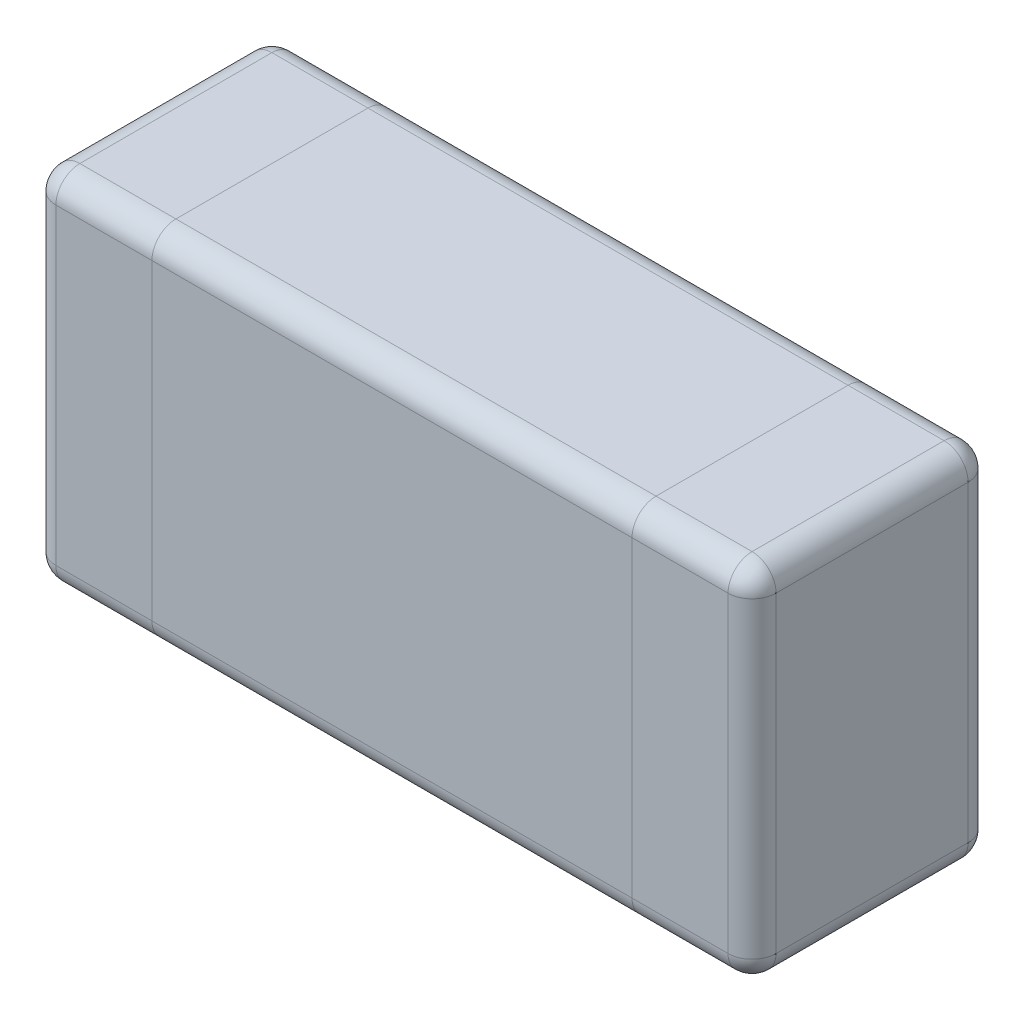
from build123d import *

# Parameters (mm, degrees)
BOSS_EXTRUDE1_DEPTH      = 0.15
BOSS_EXTRUDE1_DEPTH_BACK = 0.15
SKETCH1_W                = 0.4
SKETCH1_H                = 0.2
FILLET1_R                = 0.02
BOSS_EXTRUDE2_DEPTH      = 0.1
FILLET2_R                = 0.02


with BuildPart() as part:
    # Sketch1 → Boss-Extrude1 (new, two sides: drawn at the far end of the back side and taken through both)
    with BuildSketch(Plane(origin=(0, 0, 0), x_dir=(1, 0, 0), z_dir=(0, 1, 0)).offset(-BOSS_EXTRUDE1_DEPTH_BACK)):
        with Locations((0, -0.1)):
            Rectangle(SKETCH1_W, SKETCH1_H)
    extrude(amount=BOSS_EXTRUDE1_DEPTH + BOSS_EXTRUDE1_DEPTH_BACK)

    # Fillet1
    fillet1_edges = [part.edges().sort_by_distance(p)[0] for p in [
        (0, -0.15, 0),
        (0, 0.15, 0),
        (0, -0.15, 0.2),
        (0, 0.15, 0.2),
    ]]
    fillet(fillet1_edges, radius=FILLET1_R)


with BuildPart() as body_2:
    # Sketch2 → Boss-Extrude2 (new body)
    with BuildSketch(Plane.ZY.offset(0.2)):
        with BuildLine():
            Line((0.02, -0.15), (0.18, -0.15))
            ThreePointArc((0.18, -0.15), (0.194142136, -0.144142136), (0.2, -0.13))
            Line((0.2, -0.13), (0.2, 0.13))
            ThreePointArc((0.2, 0.13), (0.194142136, 0.144142136), (0.18, 0.15))
            Line((0.18, 0.15), (0.02, 0.15))
            ThreePointArc((0.02, 0.15), (0.005857864, 0.144142136), (0, 0.13))
            Line((0, 0.13), (0, -0.13))
            ThreePointArc((0, -0.13), (0.005857864, -0.144142136), (0.02, -0.15))
        make_face()
    extrude(amount=BOSS_EXTRUDE2_DEPTH)

    # Fillet2
    fillet2_edges = [body_2.edges().sort_by_distance(p)[0] for p in [
        (-0.3, 0, 0.2),
        (-0.3, 0.144142136, 0.194142136),
        (-0.3, 0.15, 0.1),
        (-0.3, 0.144142136, 0.005857864),
        (-0.3, 0, 0),
        (-0.3, -0.144142136, 0.005857864),
        (-0.3, -0.15, 0.1),
        (-0.3, -0.144142136, 0.194142136),
    ]]
    fillet(fillet2_edges, radius=FILLET2_R)


with BuildPart() as body_3:
    # Mirror1: mirrored copy
    add(body_2.part.mirror(Plane(origin=(0, 0, 0), x_dir=(0, 0, 1), z_dir=(1, 0, 0))))


solid = Compound([part.part, body_2.part, body_3.part])
